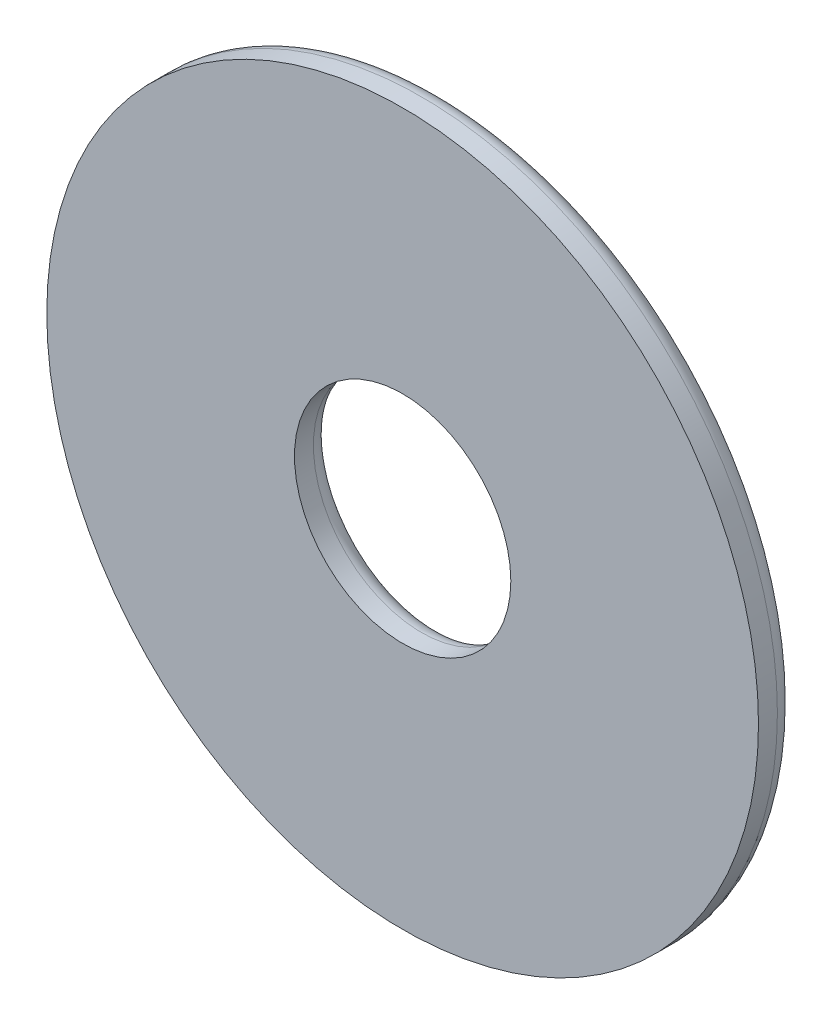
from build123d import *

# Parameters (mm, degrees)
BOSS_EXTRUDE1_DEPTH      = 0.59055
BOSS_EXTRUDE1_DEPTH_BACK = 0.59055
SKETCH3_R                = 11.1125
SKETCH3_R_2              = 3.3782
FILLET1_R                = 0.59055


with BuildPart() as part:
    # Sketch3 → Boss-Extrude1 (new, two sides: drawn at the far end of the back side and taken through both)
    with BuildSketch(Plane.XY.offset(-BOSS_EXTRUDE1_DEPTH_BACK)):
        Circle(SKETCH3_R)
        Circle(SKETCH3_R_2, mode=Mode.SUBTRACT)
    extrude(amount=BOSS_EXTRUDE1_DEPTH + BOSS_EXTRUDE1_DEPTH_BACK)

    # Fillet1
    fillet1_edges = [part.edges().sort_by_distance(p)[0] for p in [
        (-11.1125, 0, -0.59055),
        (-3.3782, 0, -0.59055),
    ]]
    fillet(fillet1_edges, radius=FILLET1_R - 0.0001)  # a hair under: the kernel refuses the full size


solid = part.part
